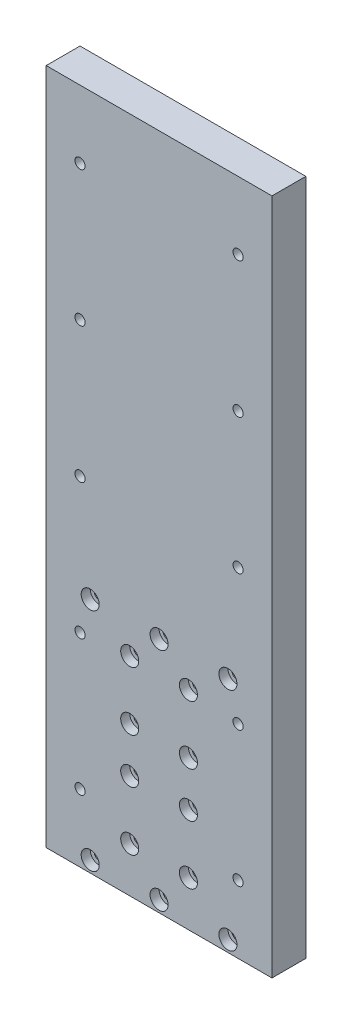
from build123d import *

# Parameters (mm, degrees)
SCHIZZO1_W                   = 100
SCHIZZO1_H                   = 300
ESTRUSIONE_ESTRUSIONE1_DEPTH = 15
SCHIZZO2_R                   = 2.25
TAGLIO_ESTRUSIONE1_DEPTH     = 317.583322366
SCHIZZO4_R                   = 4
TAGLIO_ESTRUSIONE2_DEPTH     = 4
SCHIZZO5_R                   = 2
TAGLIO_ESTRUSIONE3_DEPTH     = 317.583322366
FORO_PER_VITE_M4_1_D         = 4.5
FORO_PER_VITE_M4_1_DEPTH     = 10
FORO_PER_VITE_M4_1_TIP       = 1.351936393


with BuildPart() as part:
    # Schizzo1 → Estrusione-Estrusione1 (new body)
    with BuildSketch(Plane.XY):
        with Locations((50, 150)):
            Rectangle(SCHIZZO1_W, SCHIZZO1_H)
    extrude(amount=-ESTRUSIONE_ESTRUSIONE1_DEPTH)

    # Schizzo2 → Taglio-Estrusione1 (cut, through all)
    with BuildSketch(Plane.XY):
        with Locations((19.5, 105)):
            Circle(SCHIZZO2_R)
        with Locations((19.5, 5)):
            Circle(SCHIZZO2_R)
        with Locations((37, 20)):
            Circle(SCHIZZO2_R)
        with Locations((37, 46)):
            Circle(SCHIZZO2_R)
        with Locations((37, 66)):
            Circle(SCHIZZO2_R)
        with Locations((37, 92)):
            Circle(SCHIZZO2_R)
        with Locations((50, 105)):
            Circle(SCHIZZO2_R)
        with Locations((50, 5)):
            Circle(SCHIZZO2_R)
        with Locations((63, 92)):
            Circle(SCHIZZO2_R)
        with Locations((63, 66)):
            Circle(SCHIZZO2_R)
        with Locations((63, 46)):
            Circle(SCHIZZO2_R)
        with Locations((63, 20)):
            Circle(SCHIZZO2_R)
        with Locations((80.5, 5)):
            Circle(SCHIZZO2_R)
        with Locations((80.5, 105)):
            Circle(SCHIZZO2_R)
    extrude(amount=-TAGLIO_ESTRUSIONE1_DEPTH, mode=Mode.SUBTRACT)

    # Schizzo4 → Taglio-Estrusione2 (cut)
    with BuildSketch(Plane.XY):
        with Locations((19.5, 105)):
            Circle(SCHIZZO4_R)
        with Locations((50, 105)):
            Circle(SCHIZZO4_R)
        with Locations((80.5, 105)):
            Circle(SCHIZZO4_R)
        with Locations((37, 92)):
            Circle(SCHIZZO4_R)
        with Locations((63, 92)):
            Circle(SCHIZZO4_R)
        with Locations((37, 66)):
            Circle(SCHIZZO4_R)
        with Locations((63, 66)):
            Circle(SCHIZZO4_R)
        with Locations((37, 46)):
            Circle(SCHIZZO4_R)
        with Locations((63, 46)):
            Circle(SCHIZZO4_R)
        with Locations((19.5, 5)):
            Circle(SCHIZZO4_R)
        with Locations((37, 20)):
            Circle(SCHIZZO4_R)
        with Locations((63, 20)):
            Circle(SCHIZZO4_R)
        with Locations((50, 5)):
            Circle(SCHIZZO4_R)
        with Locations((80.5, 5)):
            Circle(SCHIZZO4_R)
    extrude(amount=-TAGLIO_ESTRUSIONE2_DEPTH, mode=Mode.SUBTRACT)

    # Schizzo5 → Taglio-Estrusione3 (cut, through all)
    with BuildSketch(Plane.XY):
        with Locations((85, 150)):
            Circle(SCHIZZO5_R)
        with Locations((85, 210)):
            Circle(SCHIZZO5_R)
        with Locations((85, 270)):
            Circle(SCHIZZO5_R)
        with Locations((85, 30)):
            Circle(SCHIZZO5_R)
        with Locations((85, 90)):
            Circle(SCHIZZO5_R)
        with Locations((15, 90)):
            Circle(SCHIZZO5_R)
        with Locations((15, 30)):
            Circle(SCHIZZO5_R)
        with Locations((15, 270)):
            Circle(SCHIZZO5_R)
        with Locations((15, 210)):
            Circle(SCHIZZO5_R)
        with Locations((15, 150)):
            Circle(SCHIZZO5_R)
    extrude(amount=-TAGLIO_ESTRUSIONE3_DEPTH, mode=Mode.SUBTRACT)

    # Foro per Vite M4-1
    with Locations(Plane(origin=(15, 270, 0), x_dir=(1, 0, 0), z_dir=(0, 0, 1))):
        with Locations((0, 0), (70, 0), (0, -60), (70, -60), (0, -120), (70, -120), (0, -180), (70, -180), (0, -240), (70, -240)):
            Hole(FORO_PER_VITE_M4_1_D / 2, depth=FORO_PER_VITE_M4_1_DEPTH)
            with Locations((0, 0, -(FORO_PER_VITE_M4_1_DEPTH + FORO_PER_VITE_M4_1_TIP / 2))):  # 118° drill point
                Cone(0, FORO_PER_VITE_M4_1_D / 2, FORO_PER_VITE_M4_1_TIP, mode=Mode.SUBTRACT)


solid = part.part
